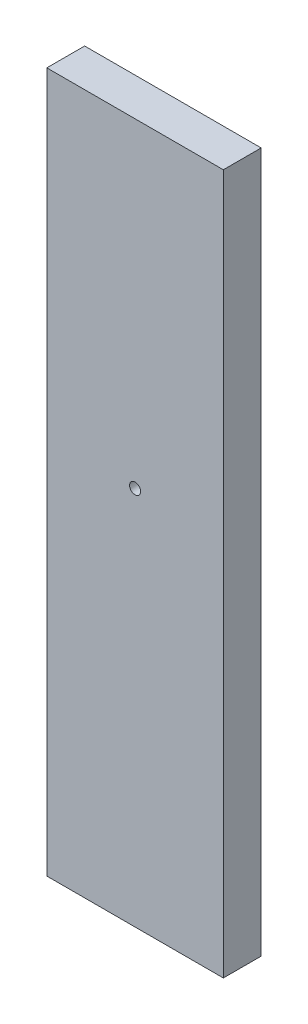
from build123d import *

# Parameters (mm, degrees)
SKETCH1_W           = 88.9
SKETCH1_H           = 19.05
BOSS_EXTRUDE1_DEPTH = 352.522028
SKETCH2_R           = 2.778125
CUT_EXTRUDE1_DEPTH  = 365.057540404


with BuildPart() as part:
    # Sketch1 → Boss-Extrude1 (new body)
    with BuildSketch(Plane(origin=(0, 0, 0), x_dir=(1, 0, 0), z_dir=(0, 1, 0))):
        with Locations((44.45, 9.525)):
            Rectangle(SKETCH1_W, SKETCH1_H)
    extrude(amount=BOSS_EXTRUDE1_DEPTH)

    # Sketch2 → Cut-Extrude1 (cut, through all)
    with BuildSketch(Plane.XY):
        with Locations((44.45, 191.301352373)):
            Circle(SKETCH2_R)
    extrude(amount=-CUT_EXTRUDE1_DEPTH, mode=Mode.SUBTRACT)


solid = part.part
